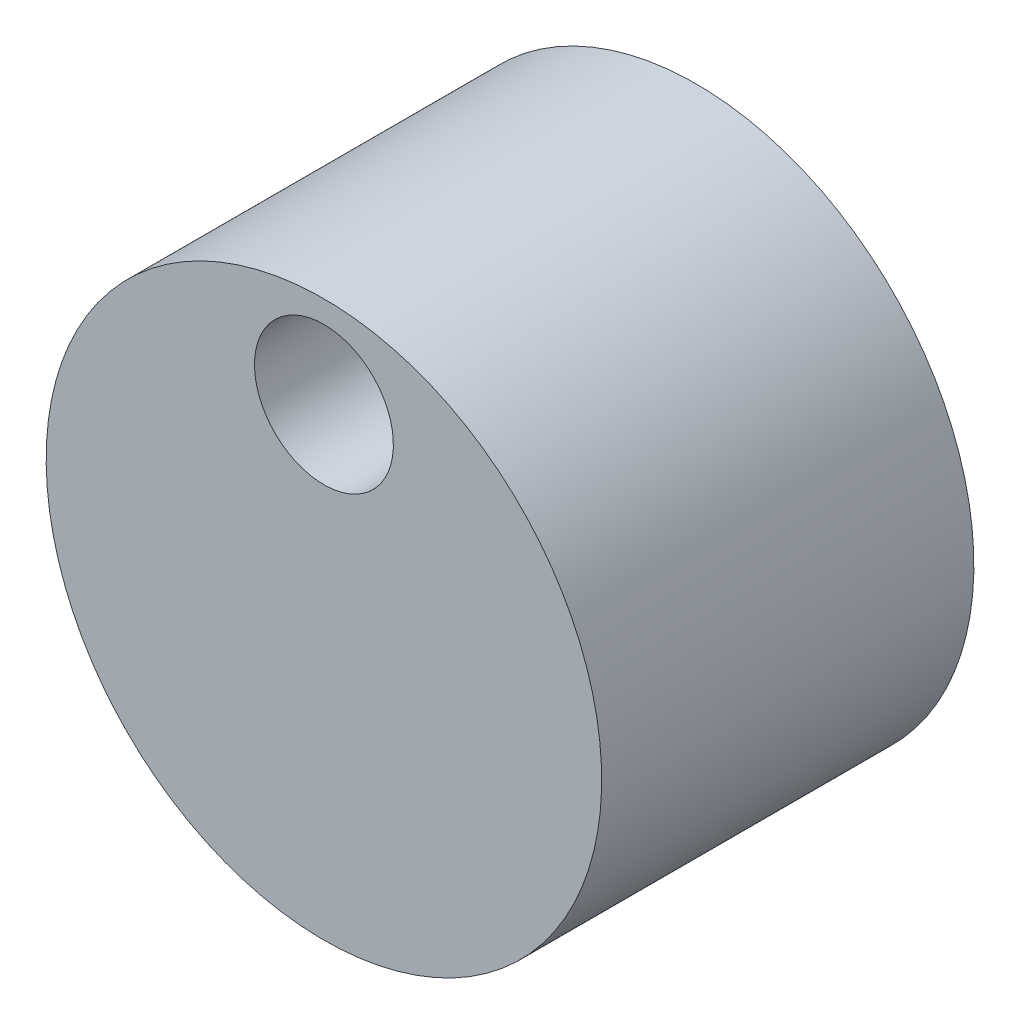
from build123d import *

# Parameters (mm, degrees)
ESQUISSE2_RX       = 12.7
ESQUISSE2_RY       = 12.7
ESQUISSE2_RX_2     = 3.175
ESQUISSE2_RY_2     = 3.175
BOSS_EXTRU_2_DEPTH = 17.018


with BuildPart() as part:
    # Esquisse2 → Boss.-Extru.2 (new body)
    with BuildSketch(Plane.XY):
        with Locations(Location((0, 0), (0, 0, -139.363511392))):
            Ellipse(ESQUISSE2_RX, ESQUISSE2_RY)
        with Locations(Location((0, 8.509), (0, 0, 32.73784229))):
            Ellipse(ESQUISSE2_RX_2, ESQUISSE2_RY_2, mode=Mode.SUBTRACT)
    extrude(amount=BOSS_EXTRU_2_DEPTH)


solid = part.part
